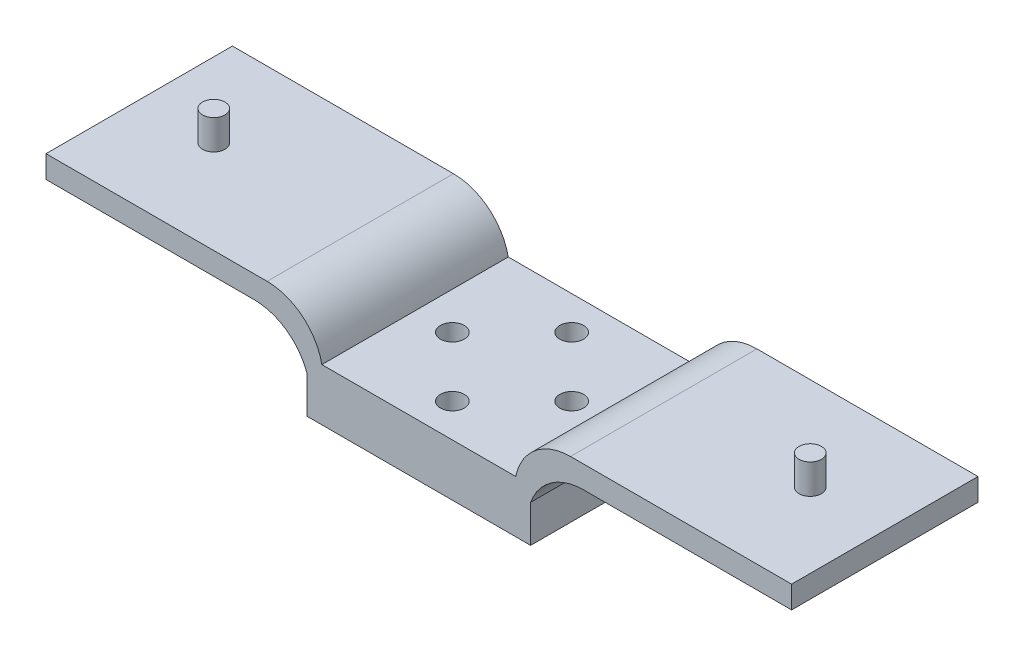
from build123d import *

# Parameters (mm, degrees)
SKETCH1_W           = 100
SKETCH1_H           = 25
BOSS_EXTRUDE1_DEPTH = 3
SKETCH2_W           = 30
SKETCH2_H           = 25
BOSS_EXTRUDE2_DEPTH = 5
SKETCH5_R           = 1.6
CUT_EXTRUDE2_DEPTH  = 53.156015952
SKETCH6_W           = 26
SKETCH6_H           = 6
CUT_EXTRUDE3_DEPTH  = 57.124860802
FILLET1_R           = 7.5
SKETCH7_R           = 1.5
BOSS_EXTRUDE3_DEPTH = 4
BOSS_EXTRUDE4_START = 5
SKETCH9_W           = 30
SKETCH9_H           = 25
SKETCH9_R           = 1.6
BOSS_EXTRUDE4_DEPTH = 5


with BuildPart() as part:
    # Sketch1 → Boss-Extrude1 (new body)
    with BuildSketch(Plane(origin=(0, 0, 0), x_dir=(1, 0, 0), z_dir=(0, 1, 0))):
        Rectangle(SKETCH1_W, SKETCH1_H)
    extrude(amount=BOSS_EXTRUDE1_DEPTH)

    # Sketch2 → Boss-Extrude2 (add)
    with BuildSketch(Plane.XZ):
        Rectangle(SKETCH2_W, SKETCH2_H)
    extrude(amount=BOSS_EXTRUDE2_DEPTH)

    # Sketch5 → Cut-Extrude2 (cut, through all)
    with BuildSketch(Plane.XZ.offset(5)):
        with Locations(Location((8, 0, 0), (0, 0, 270))):
            Circle(SKETCH5_R)
        with Locations(Location((0, -8, 0), (0, 0, 270))):
            Circle(SKETCH5_R)
        with Locations(Location((-8, 0, 0), (0, 0, 270))):
            Circle(SKETCH5_R)
        with Locations(Location((0, 8, 0), (0, 0, 270))):
            Circle(SKETCH5_R)
    extrude(amount=-CUT_EXTRUDE2_DEPTH, mode=Mode.SUBTRACT)

    # Sketch6 → Cut-Extrude3 (cut, through all)
    with BuildSketch(Plane(origin=(0, 0, -12.5), x_dir=(-1, 0, 0), z_dir=(0, 0, -1))):
        Rectangle(SKETCH6_W, SKETCH6_H)
    extrude(amount=-CUT_EXTRUDE3_DEPTH, mode=Mode.SUBTRACT)

    # Fillet1
    # the kernel refuses this fillet: 7.5 mm, written as the material it adds along each edge
    with BuildSketch(Plane(origin=(-15, 0, -12.5), x_dir=(-1, 0, 0), z_dir=(0, 0, 1))) as fillet1_piece_1:
        with BuildLine():
            CenterArc((7.071067812, 7.5), FILLET1_R, 199.471220634, 70.528779366)
            Line((0, 5), (-0.141421356, 4.95))
            ThreePointArc((-0.141421356, 4.95), (-0.15, 2.5), (-0.15, 0))
            Line((-0.15, 0), (0, -0.15))
            Line((0, -0.15), (7.071067812, -0.15))
            Line((7.071067812, -0.15), (7.071067812, 0))
        make_face()
    extrude(amount=25)
    with BuildSketch(Plane(origin=(15, 0, 12.5), x_dir=(0, -1, 0), z_dir=(0, 0, -1))) as fillet1_piece_2:
        with BuildLine():
            CenterArc((7.5, -7.071067812), FILLET1_R, 109.471220634, 70.528779366)
            Line((0, -7.071067812), (-0.15, -7.071067812))
            Line((-0.15, -7.071067812), (-0.15, 0))
            Line((-0.15, 0), (0, 0.15))
            ThreePointArc((0, 0.15), (2.5, 0.15), (4.95, 0.141421356))
            Line((4.95, 0.141421356), (5, 0))
        make_face()
    extrude(amount=25)
    # the kernel refuses this fillet: 7.5 mm, written as the material it takes off along each edge
    with BuildSketch(Plane(origin=(-13, 3, -30.871173071), x_dir=(-1.5711876244490177e-12, -1.0, 0), z_dir=(0, 0, 1))) as fillet1_2_piece_1:
        with BuildLine():
            CenterArc((7.5, -7.348469228), FILLET1_R, 101.536959033, 78.463040967)
            Line((0, -7.348469228), (-0.15, -7.348469228))
            Line((-0.15, -7.348469228), (-0.15, 0))
            Line((-0.15, 0), (0, 0.15))
            ThreePointArc((0, 0.15), (3, 0.15), (5.97, 0.146969385))
            Line((5.97, 0.146969385), (6, 0))
        make_face()
    extrude(amount=61.742346142, mode=Mode.SUBTRACT)
    with BuildSketch(Plane(origin=(13, 3, -30.871173071), x_dir=(1, 0, 0), z_dir=(0, 0, 1))) as fillet1_2_piece_2:
        with BuildLine():
            CenterArc((7.348469228, -7.5), FILLET1_R, 90, 78.463040967)
            Line((0, -6), (-0.146969385, -5.97))
            ThreePointArc((-0.146969385, -5.97), (-0.15, -3), (-0.15, 0))
            Line((-0.15, 0), (0, 0.15))
            Line((0, 0.15), (7.348469228, 0.15))
            Line((7.348469228, 0.15), (7.348469228, 0))
        make_face()
    extrude(amount=61.742346142, mode=Mode.SUBTRACT)

    # Sketch7 → Boss-Extrude3 (add)
    with BuildSketch(Plane(origin=(0, 3, 0), x_dir=(1, 0, 0), z_dir=(0, 1, 0))):
        with Locations(Location((-40, 0, 0), (0, 0, 270))):
            Circle(SKETCH7_R)
        with Locations(Location((40, 0, 0), (0, 0, 270))):
            Circle(SKETCH7_R)
    extrude(amount=BOSS_EXTRUDE3_DEPTH)

    # Sketch9 → Boss-Extrude4 (add)
    with BuildSketch(Plane.XZ.offset(5).offset(BOSS_EXTRUDE4_START)):
        Rectangle(SKETCH9_W, SKETCH9_H)
        with Locations(Location((0, -8, 0), (0, 0, 270))):
            Circle(SKETCH9_R, mode=Mode.SUBTRACT)
        with Locations(Location((-8, 0, 0), (0, 0, 270))):
            Circle(SKETCH9_R, mode=Mode.SUBTRACT)
        with Locations(Location((8, 0, 0), (0, 0, 270))):
            Circle(SKETCH9_R, mode=Mode.SUBTRACT)
        with Locations(Location((0, 8, 0), (0, 0, 270))):
            Circle(SKETCH9_R, mode=Mode.SUBTRACT)
    extrude(amount=-BOSS_EXTRUDE4_DEPTH)


solid = part.part
